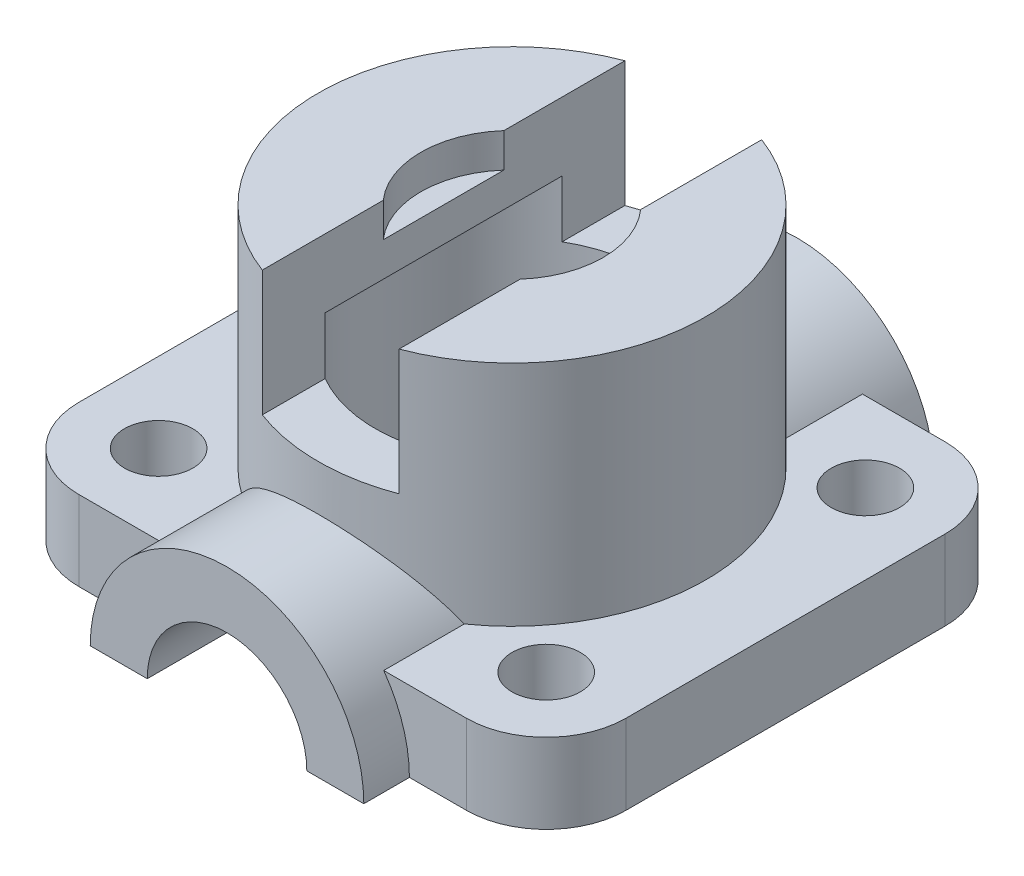
from build123d import *
from build123d.topology import SkipClean

# Parameters (mm, degrees)
EXTRUDE_1_DEPTH     = 50
SKETCH_7_R          = 3
EXTRUDE_2_DEPTH     = 7
SKETCH_8_R          = 17
EXTRUDE_3_DEPTH     = 27
SKETCH_9_R          = 8
CUT_EXTRUDE_1_DEPTH = 3
SKETCH_11_W         = 12
SKETCH_11_H         = 11
CUT_EXTRUDE_3_DEPTH = 20
SKETCH_12_R         = 12
CUT_EXTRUDE_4_DEPTH = 21
SKETCH_13_R         = 7
CUT_EXTRUDE_5_DEPTH = 62.684682178


with BuildPart() as part:
    # 草图1 → 凸台-拉伸1 (new body)
    with BuildSketch(Plane.XY.offset(25)):
        with BuildLine():
            Line((-12, 0), (-7, 0))
            ThreePointArc((-7, 0), (0, 7), (7, 0))
            Line((7, 0), (12, 0))
            ThreePointArc((12, 0), (0, 12), (-12, 0))
        make_face()
    extrude(amount=-EXTRUDE_1_DEPTH)

    # 草图7 → 凸台-拉伸2 (add)
    with BuildSketch(Plane(origin=(0, 0, 0), x_dir=(1, 0, 0), z_dir=(0, 1, 0))):
        with BuildLine():
            Line((-17, -21), (17, -21))
            ThreePointArc((17, -21), (21.949747468, -18.949747468), (24, -14))
            Line((24, -14), (24, 14))
            ThreePointArc((24, 14), (21.949747468, 18.949747468), (17, 21))
            Line((17, 21), (-17, 21))
            ThreePointArc((-17, 21), (-21.949747468, 18.949747468), (-24, 14))
            Line((-24, 14), (-24, -14))
            ThreePointArc((-24, -14), (-21.949747468, -18.949747468), (-17, -21))
        make_face()
        with Locations((-17, 14)):
            Circle(SKETCH_7_R, mode=Mode.SUBTRACT)
        with Locations((17, 14)):
            Circle(SKETCH_7_R, mode=Mode.SUBTRACT)
        with Locations((17, -14)):
            Circle(SKETCH_7_R, mode=Mode.SUBTRACT)
        with Locations((-17, -14)):
            Circle(SKETCH_7_R, mode=Mode.SUBTRACT)
    extrude(amount=EXTRUDE_2_DEPTH)

    # 草图8 → 凸台-拉伸3 (add)
    with BuildSketch(Plane(origin=(0, 0, 0), x_dir=(1, 0, 0), z_dir=(0, 1, 0))):
        Circle(SKETCH_8_R)
    extrude(amount=EXTRUDE_3_DEPTH)

    # 草图9 → 切除-拉伸1 (cut)
    with BuildSketch(Plane(origin=(0, 27, 0), x_dir=(1, 0, 0), z_dir=(0, 1, 0))):
        Circle(SKETCH_9_R)
    extrude(amount=-CUT_EXTRUDE_1_DEPTH, mode=Mode.SUBTRACT)

    # 草图11 → 切除-拉伸3 (cut, symmetric)
    with BuildSketch(Plane.XY):
        with Locations((0, 21.5)):
            Rectangle(SKETCH_11_W, SKETCH_11_H)
    extrude(amount=CUT_EXTRUDE_3_DEPTH, both=True, mode=Mode.SUBTRACT)

    # 草图12 → 切除-拉伸4 (cut)
    with BuildSketch(Plane(origin=(0, 0, 0), x_dir=(1, 0, 0), z_dir=(0, 1, 0))):
        Circle(SKETCH_12_R)
    extrude(amount=CUT_EXTRUDE_4_DEPTH, mode=Mode.SUBTRACT)

    # 草图13 → 切除-拉伸5 (cut, through all)
    with SkipClean():  # the faces are left unmerged after this step: merging them gives an invalid solid
        with BuildSketch(Plane.XY.offset(25)):
            Circle(SKETCH_13_R)
        extrude(amount=-CUT_EXTRUDE_5_DEPTH, mode=Mode.SUBTRACT)
    add(part.part.scale(1), mode=Mode.REPLACE)  # the faces are merged on a copy


solid = part.part
